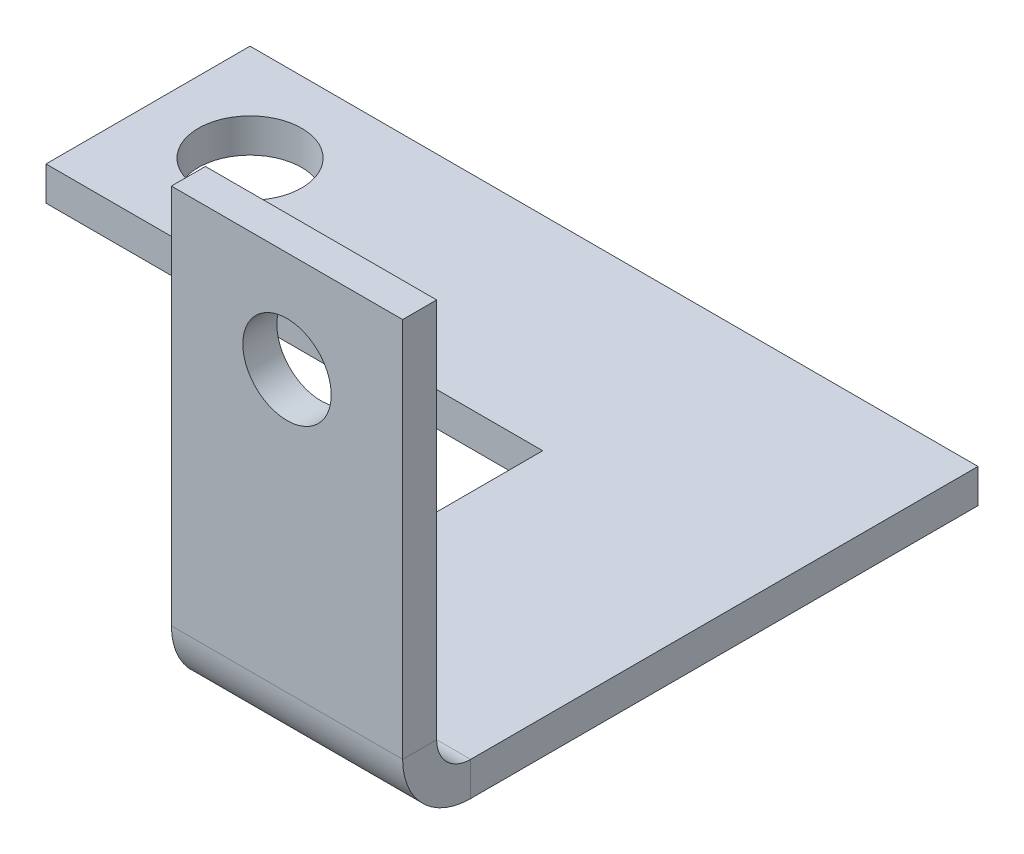
from build123d import *

# Parameters (mm, degrees)
SKETCH1_W                    = 21.59
SKETCH1_H                    = 41.91
SKETCH1_R                    = 4.124999878
BOSS_EXTRUDE1_DEPTH          = 3.175
EDGE_FLANGE2_STRIP_W         = 19.05
EDGE_FLANGE2_STRIP_H         = 3.175
EDGE_FLANGE2_STRIP_CUT_DEPTH = 21.59
EDGE_FLANGE2_DEPTH           = 21.59
EDGE_FLANGE2_FLAT_DEPTH      = 3.175
SKETCH12_R                   = 4.826
CUT_EXTRUDE1_DEPTH           = 79.776992708


# Sheet-metal steps are written as plain solids
with BuildPart() as part:
    # Sketch1 → Boss-Extrude1 (new body)
    with BuildSketch(Plane.XY):
        with Locations((10.795, 20.955)):
            Rectangle(SKETCH1_W, SKETCH1_H)
        with Locations(Location((10.795, 32.475227484, 0), (0, 0, 180))):
            Circle(SKETCH1_R, mode=Mode.SUBTRACT)
    extrude(amount=BOSS_EXTRUDE1_DEPTH)

    # Edge-Flange2 strip (across the edge) → Edge-Flange2 strip cut (cut)
    with BuildSketch(Plane(origin=(21.59, 0, 0), x_dir=(0, 1, 0), z_dir=(-1, 0, 0))):
        with Locations((-3.175, -1.5875)):
            Rectangle(EDGE_FLANGE2_STRIP_W, EDGE_FLANGE2_STRIP_H)
    extrude(amount=EDGE_FLANGE2_STRIP_CUT_DEPTH, mode=Mode.SUBTRACT)

    # Edge-Flange2 bend section (across the edge) → Edge-Flange2 (add)
    with BuildSketch(Plane(origin=(21.59, 0, 0), x_dir=(0, 1, 0), z_dir=(-1, 0, 0))):
        with BuildLine():
            Line((0, 3.175), (3.175, 3.175))
            ThreePointArc((3.175, 3.175), (4.10493597, 0.92993597), (6.35, 0))
            Line((6.35, 0), (6.35, -3.175))
            ThreePointArc((6.35, -3.175), (1.859871939, -1.315128061), (0, 3.175))
        make_face()
    extrude(amount=EDGE_FLANGE2_DEPTH)

    # Edge-Flange2 profile (on flange) → Edge-Flange2 flat (add)
    with BuildSketch(Plane(origin=(0, 0, 0), x_dir=(-1, 0, 0), z_dir=(0, -1, 0))):
        Polygon((0, 3.175), (0, 31.493260102), (27.326645128, 31.493260102), (46.376645128, 31.493260102), (46.376645128, 50.543260102), (27.326645128, 50.543260102), (0, 50.543260102), (-21.59, 50.543260102), (-21.59, 3.175), align=None)
    extrude(amount=-EDGE_FLANGE2_FLAT_DEPTH)

    # Sketch12 → Cut-Extrude1 (cut, through all)
    with BuildSketch(Plane(origin=(0, 3.175, 0), x_dir=(1, 0, 0), z_dir=(0, 1, 0))):
        with Locations(Location((-37.326625128, 41.493240102, 0), (0, 0, 270))):
            Circle(SKETCH12_R)
    extrude(amount=-CUT_EXTRUDE1_DEPTH, mode=Mode.SUBTRACT)


solid = part.part
